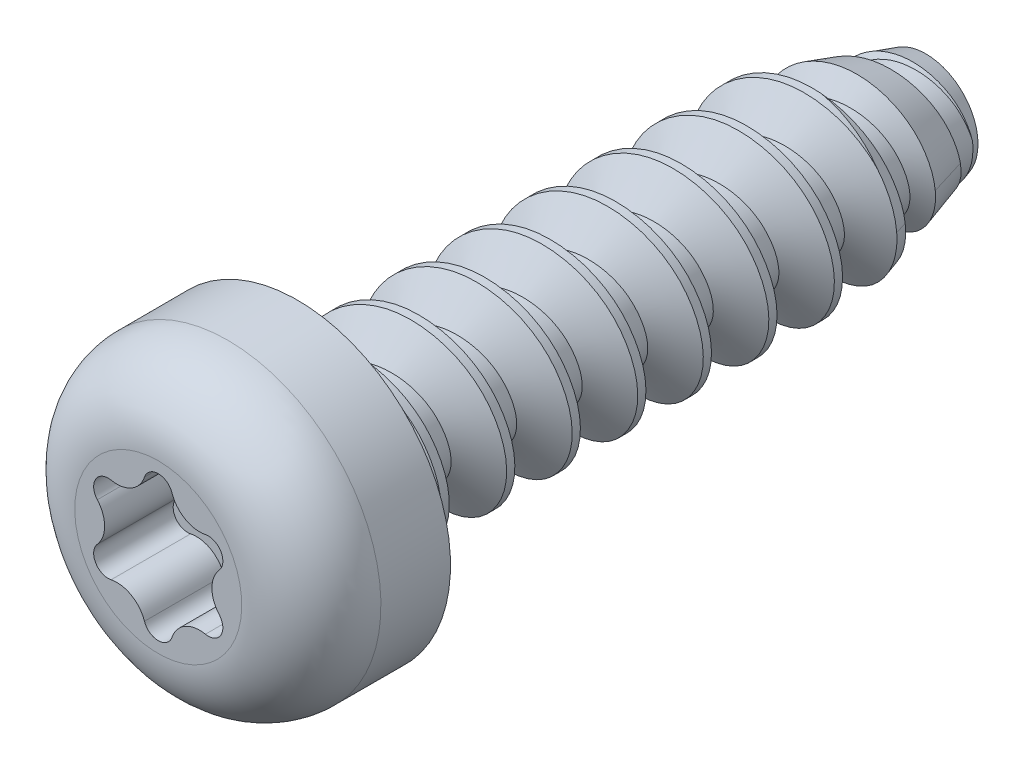
from build123d import *

# Parameters (mm, degrees)
SKETCH1_R           = 3.41
EXTRUDE3_DEPTH      = 3.1
SKETCH4_W           = 14
SKETCH4_H           = 1.209751819
SWEEP1_PITCH        = 1.46
LPATTERN3_COUNT     = 10
LPATTERN3_PITCH     = 1.46
LPATTERN3_COL_COUNT = 2
LPATTERN3_COL_PITCH = 1.46
CUT_EXTRUDE1_DEPTH  = 1.771428571
CIRPATTERN1_COUNT   = 6


with BuildPart() as part:
    # Sketch1 → Extrude3 (new body)
    with BuildSketch(Plane.XY):
        with Locations(Location((0, 0, 0), (0, 0, 180))):
            Circle(SKETCH1_R)
    extrude(amount=EXTRUDE3_DEPTH)

    # Sketch11 → Cut-Revolve3 (revolve, cut)
    with BuildSketch(Plane(origin=(0, 0, 0), x_dir=(0, 0, -1), z_dir=(1, 0, 0)), mode=Mode.PRIVATE) as cut_revolve3_sk:
        with BuildLine():
            Line((-1.55, 3.41), (-1.55, 3.51))
            Line((-1.55, 3.51), (-3.2, 3.51))
            Line((-3.2, 3.51), (-3.2, 1.86))
            Line((-3.2, 1.86), (-3.1, 1.86))
            ThreePointArc((-3.1, 1.86), (-2.646015511, 2.956015511), (-1.55, 3.41))
        make_face()
    revolve(cut_revolve3_sk.sketch.rotate(Axis((0, 0, 0), (0, 0, 1)), 90), axis=Axis((0, 0, 0), (0, 0, 1)), mode=Mode.SUBTRACT)


with BuildPart() as body_2:
    # Sketch4 → Revolve1 (revolve)
    with BuildSketch(Plane(origin=(0, 0, 0), x_dir=(0, 0, -1), z_dir=(1, 0, 0))):
        with Locations((7, 0.60487591)):
            Rectangle(SKETCH4_W, SKETCH4_H)
    revolve(axis=Axis((0, 0, -14), (0, 0, -1)))

    # Sweep1: the profile of Sketch14 profile screwed along a right-hand helix of 1.5 turns, 6 arcs to a turn; built about Z, then put on its axis
    sweep1_z = Axis((0, 0, 0), (0, 0, 1))
    sweep1_corners = [(2, 0, -0.09125), (2, 0, 0.09125), (1.209451819, 0, 0.547673205), (1.209451819, 0, -0.547673205)]
    with BuildLine(mode=Mode.PRIVATE) as sweep1_profile:
        Line(sweep1_corners[0], sweep1_corners[1])
        Line(sweep1_corners[1], sweep1_corners[2])
        Line(sweep1_corners[2], sweep1_corners[3])
        Line(sweep1_corners[3], sweep1_corners[0])
    sweep1_cap = Face(sweep1_profile.wire())
    sweep1_turn_angles = [0, 30, 60, 90, 120, 150, 180, 210, 240, 270, 300, 330, 360]
    sweep1_turn_weights = [1, 0.8660254037844387, 1, 0.8660254037844387, 1, 0.8660254037844387, 1, 0.8660254037844387, 1, 0.8660254037844387, 1, 0.8660254037844387, 1]
    sweep1_turn_rails = [Edge.make_bspline([Vector(p[0], p[1], 0).rotate(sweep1_z, sweep1_turn_angles[k]) / sweep1_turn_weights[k] + Vector(0, 0, p[2] + SWEEP1_PITCH * sweep1_turn_angles[k] / 360) for k in range(13)], [0, 0, 0, 1, 1, 2, 2, 3, 3, 4, 4, 5, 5, 6, 6, 6], 2, sweep1_turn_weights) for p in sweep1_corners]
    sweep1_turn_sides = [Face.make_surface_from_curves(sweep1_turn_rails[p[0]], sweep1_turn_rails[p[1]]) for p in [(0, 1), (1, 2), (2, 3), (3, 0)]]
    sweep1_last_angles = [360, 390, 420, 450, 480, 510, 540]
    sweep1_last_weights = [1, 0.8660254037844387, 1, 0.8660254037844387, 1, 0.8660254037844337, 1]
    sweep1_last_rails = [Edge.make_bspline([Vector(p[0], p[1], 0).rotate(sweep1_z, sweep1_last_angles[k]) / sweep1_last_weights[k] + Vector(0, 0, p[2] + SWEEP1_PITCH * sweep1_last_angles[k] / 360) for k in range(7)], [0, 0, 0, 1, 1, 2, 2, 3, 3, 3], 2, sweep1_last_weights) for p in sweep1_corners]
    sweep1_last_sides = [Face.make_surface_from_curves(sweep1_last_rails[p[0]], sweep1_last_rails[p[1]]) for p in [(0, 1), (1, 2), (2, 3), (3, 0)]]
    sweep1 = Plane(origin=(0, 0, -0.9125), x_dir=(0, 1, 0), z_dir=(0, 0, -1)) * Solid(Shell([*sweep1_turn_sides, *sweep1_last_sides, sweep1_cap, sweep1_cap.rotate(sweep1_z, 540).moved(Location((0, 0, SWEEP1_PITCH * 540 / 360)))]))
    add(sweep1)

    # LPattern3: Sweep1 ×10
    with Locations(*[(0, 0, -i * LPATTERN3_PITCH) for i in range(1, LPATTERN3_COUNT)]):
        add(sweep1)


with BuildPart() as part_1:
    add(part.part)

    add(body_2.part)  # LPattern3 col merges body 2
    # LPattern3 col: Sweep1 ×2
    with Locations(*[(0, 0, i * LPATTERN3_COL_PITCH) for i in range(1, LPATTERN3_COL_COUNT)]):
        add(sweep1)

    # Sketch13 → Cut-Revolve4 (revolve, cut)
    with BuildSketch(Plane(origin=(0, 0, 0), x_dir=(0, 0, -1), z_dir=(1, 0, 0)), mode=Mode.PRIVATE) as cut_revolve4_sk:
        Polygon((14, 1.159751819), (11.268278773, 2), (14, 2), (16.92, 2), (16.92, 0), (14, 0), align=None)
    revolve(cut_revolve4_sk.sketch.rotate(Axis((0, 0, 0), (0, 0, -1)), 90), axis=Axis((0, 0, 0), (0, 0, -1)), mode=Mode.SUBTRACT)

    # Sketch12 → Cut-Extrude1 (cut)
    with BuildSketch(Plane.XY.offset(3.1)):
        with BuildLine():
            Line((-0.597538556, 1.034967139), (0, 0))
            Line((0, 0), (0.597538556, 1.034967139))
            ThreePointArc((0.597538556, 1.034967139), (0.419852425, 1.186021584), (0.307162852, 1.390204999))
            ThreePointArc((0.307162852, 1.390204999), (0, 1.611225), (-0.307162852, 1.390204999))
            ThreePointArc((-0.307162852, 1.390204999), (-0.419852425, 1.186021584), (-0.597538556, 1.034967139))
        make_face()
    cut_extrude1 = extrude(amount=-CUT_EXTRUDE1_DEPTH, mode=Mode.SUBTRACT)

    # CirPattern1: Cut-Extrude1 ×6 about axis
    cirpattern1_axis = Axis((0, 0, 0), (0, 0, 1))
    for i in range(1, CIRPATTERN1_COUNT):
        add(cut_extrude1.rotate(cirpattern1_axis, i * 360 / CIRPATTERN1_COUNT), mode=Mode.SUBTRACT)


solid = part_1.part
